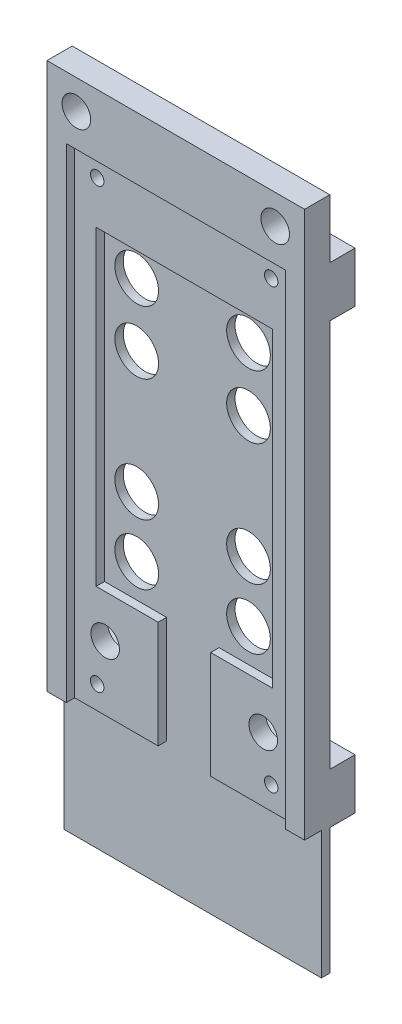
from build123d import *
from build123d.topology import SkipClean

# Parameters (mm, degrees)
SKETCH1_W                   = 32.65
SKETCH1_H                   = 81.2
BOSS_EXTRUDE1_DEPTH         = 1
BOSS_EXTRUDE2_DEPTH         = 4
SKETCH3_W                   = 5.2
SKETCH3_H                   = 5.2
BOSS_EXTRUDE3_DEPTH         = 1
F_3DSKETCH1_R               = 2
CUT_EXTRUDE13_DEPTH         = 15
F_3DSKETCH2_R               = 2.6
CUT_EXTRUDE14_DEPTH         = 24
CUT_EXTRUDE20_START         = -6.9
SKETCH7_R                   = 2
CUT_EXTRUDE20_DEPTH         = 6.9
SKETCH8_W                   = 1
SKETCH8_H                   = 5
CUT_EXTRUDE21_DEPTH         = 88.661066044
SKETCH9_W                   = 5
SKETCH9_H                   = 1
CUT_EXTRUDE23_DEPTH         = 87.935967815
SKETCH11_W                  = 10
SKETCH11_H                  = 6
BOSS_EXTRUDE4_DEPTH         = 3
TAP_DRILL_FOR_M2X0_4_TAP1_D = 1.6
TAP_DRILL_FOR_M2X0_4_TAP2_D = 1.6
SKETCH37_R                  = 0.8
BOSS_EXTRUDE11_DEPTH        = 1
SKETCH40_W                  = 2.3
SKETCH40_H                  = 65
BOSS_EXTRUDE12_DEPTH        = 1
SKETCH41_W                  = 26.05
SKETCH41_H                  = 7.4
BOSS_EXTRUDE13_DEPTH        = 1
M3_CLEARANCE_HOLE1_D        = 3.4
M3_CLEARANCE_HOLE2_D        = 3.4


with BuildPart() as part:
    # Sketch1 → Boss-Extrude1 (new body)
    with BuildSketch(Plane.XY):
        with Locations((16.325, 40.6)):
            Rectangle(SKETCH1_W, SKETCH1_H)
    extrude(amount=BOSS_EXTRUDE1_DEPTH)

    # Sketch2 → Boss-Extrude2 (add)
    with BuildSketch(Plane.XY.offset(1)):
        Polygon((0, 0), (0, 81.2), (32.65, 81.2), (32.65, 0), (31.65, 0), (31.65, 80.2), (1, 80.2), (1, 0), align=None)
    extrude(amount=BOSS_EXTRUDE2_DEPTH)

    # Sketch3 → Boss-Extrude3 (add)
    with BuildSketch(Plane.XY.offset(1)):
        with Locations((3.6, 77.6)):
            Rectangle(SKETCH3_W, SKETCH3_H)
        with Locations((3.6, 17.8)):
            Rectangle(SKETCH3_W, SKETCH3_H)
        with Locations((29.05, 17.8)):
            Rectangle(SKETCH3_W, SKETCH3_H)
        with Locations((29.05, 77.6)):
            Rectangle(SKETCH3_W, SKETCH3_H)
    extrude(amount=BOSS_EXTRUDE3_DEPTH)

    # 3DSketch1 → Cut-Extrude13 (cut)
    with BuildSketch(Plane(origin=(11.325, 80.2, 4), x_dir=(1, 0, 0), z_dir=(0, -1, 0))):
        Circle(F_3DSKETCH1_R)
        with Locations((10, 0)):
            Circle(F_3DSKETCH1_R)
    extrude(amount=-CUT_EXTRUDE13_DEPTH, mode=Mode.SUBTRACT)

    # 3DSketch2 → Cut-Extrude14 (cut)
    with BuildSketch(Plane(origin=(9.675, 61.1, 1), x_dir=(0.4145072564800623, -0.910046006708107, 0), z_dir=(0, 0, 1))):
        with Locations(Location((0, 0, 0), (0, 0, 245.511710088))):
            Circle(F_3DSKETCH2_R)
        with Locations(Location((5.512946511, 12.103611889, 0), (0, 0, 245.511710088))):
            Circle(F_3DSKETCH2_R)
        with Locations(Location((6.82534505, -3.108804424, 0), (0, 0, 245.511710088))):
            Circle(F_3DSKETCH2_R)
        with Locations(Location((12.338291561, 8.994807466, 0), (0, 0, 245.511710088))):
            Circle(F_3DSKETCH2_R)
        with Locations(Location((20.021012148, -9.119159643, 0), (0, 0, 245.511710088))):
            Circle(F_3DSKETCH2_R)
        with Locations(Location((25.533958659, 2.984452247, 0), (0, 0, 245.511710088))):
            Circle(F_3DSKETCH2_R)
        with Locations(Location((26.573343396, -12.103611889, 0), (0, 0, 245.511710088))):
            Circle(F_3DSKETCH2_R)
        with Locations(Location((32.086289907, 0, 0), (0, 0, 245.511710088))):
            Circle(F_3DSKETCH2_R)
    extrude(amount=-CUT_EXTRUDE14_DEPTH, mode=Mode.SUBTRACT)

    # Sketch7 → Cut-Extrude20 (cut)
    with BuildSketch(Plane(origin=(0, 81.2, 0), x_dir=(1, 0, 0), z_dir=(0, 1, 0)).offset(CUT_EXTRUDE20_START)):
        with BuildLine():
            ThreePointArc((13.057050808, -5), (13.256851653, -4.51763809), (13.325, -4))
            ThreePointArc((13.325, -4), (10.80736191, -2.068148347), (9.592949192, -5))
            Line((9.592949192, -5), (13.057050808, -5))
        make_face()
        with BuildLine():
            Line((13.057050808, -5), (9.592949192, -5))
            ThreePointArc((9.592949192, -5), (11.325, -6), (13.057050808, -5))
        make_face()
        with BuildLine():
            ThreePointArc((9.592949192, -5), (11.325, -2), (13.057050808, -5))
            Line((13.057050808, -5), (9.592949192, -5))
        make_face()
        with Locations((21.308255446, -4.002965824)):
            Circle(SKETCH7_R)
    extrude(amount=CUT_EXTRUDE20_DEPTH, mode=Mode.SUBTRACT)

    # Sketch8 → Cut-Extrude21 (cut, through all)
    with BuildSketch(Plane.XZ):
        Polygon((1, 5), (0, 5), (0, 0), (1, 0), (1, 1), align=None)
        with Locations((32.15, 2.5)):
            Rectangle(SKETCH8_W, SKETCH8_H)
    extrude(amount=-CUT_EXTRUDE21_DEPTH, mode=Mode.SUBTRACT)

    # Sketch9 → Cut-Extrude23 (cut, through all)
    with BuildSketch(Plane(origin=(31.65, 0, 0), x_dir=(0, 0, -1), z_dir=(1, 0, 0))):
        with Locations((-2.5, 80.7)):
            Rectangle(SKETCH9_W, SKETCH9_H)
    extrude(amount=-CUT_EXTRUDE23_DEPTH, mode=Mode.SUBTRACT)

    # Sketch11 → Boss-Extrude4 (add)
    with BuildSketch(Plane(origin=(0, 0, 0), x_dir=(-1, 0, 0), z_dir=(0, 0, -1))):
        with Locations((-26.65, 18)):
            Rectangle(SKETCH11_W, SKETCH11_H)
        with Locations((-26.65, 70.2)):
            Rectangle(SKETCH11_W, SKETCH11_H)
        with Locations((-6, 70.2)):
            Rectangle(SKETCH11_W, SKETCH11_H)
        with Locations((-6, 18)):
            Rectangle(SKETCH11_W, SKETCH11_H)
    extrude(amount=BOSS_EXTRUDE4_DEPTH)

    # Tap Drill for M2x0.4 Tap1 (through all)
    with Locations(Plane(origin=(26.675, 70.1, 2), x_dir=(1, 0, 0), z_dir=(0, 0, 1))):
        with Locations((0, 0)):
            Hole(TAP_DRILL_FOR_M2X0_4_TAP1_D / 2)

    # Tap Drill for M2x0.4 Tap2 (through all)
    with Locations(Plane(origin=(5.975, 70.1, 2), x_dir=(1, 0, 0), z_dir=(0, 0, 1))):
        with Locations((0, 0), (0, -52.15), (20.702261821, -52.15)):
            Hole(TAP_DRILL_FOR_M2X0_4_TAP2_D / 2)

    # Sketch37 → Boss-Extrude11 (add)
    with SkipClean():  # the faces are left unmerged after this step: merging them gives an invalid solid
        with BuildSketch(Plane.XY.offset(1)):
            with BuildLine():
                Line((26.85, 64.95), (26.85, 27.95))
                Line((26.85, 27.95), (19.475, 27.95))
                Line((19.475, 27.95), (19.475, 15.2))
                Line((19.475, 15.2), (26.45, 15.2))
                Line((26.45, 15.2), (26.45, 17.18295889))
                ThreePointArc((26.45, 17.18295889), (25.877261821, 17.95), (26.45, 18.71704111))
                Line((26.45, 18.71704111), (26.45, 20.4))
                Line((26.45, 20.4), (31.65, 20.4))
                Line((31.65, 20.4), (31.65, 75))
                Line((31.65, 75), (26.45, 75))
                Line((26.45, 75), (26.45, 80.2))
                Line((26.45, 80.2), (6.2, 80.2))
                Line((6.2, 80.2), (6.2, 75))
                Line((6.2, 75), (1, 75))
                Line((1, 75), (1, 20.4))
                Line((1, 20.4), (6.2, 20.4))
                Line((6.2, 20.4), (6.2, 18.717707627))
                ThreePointArc((6.2, 18.717707627), (6.775, 17.95), (6.2, 17.182292373))
                Line((6.2, 17.182292373), (6.2, 15.2))
                Line((6.2, 15.2), (13.225, 15.2))
                Line((13.225, 15.2), (13.225, 27.95))
                Line((13.225, 27.95), (5.85, 27.95))
                Line((5.85, 27.95), (5.85, 64.95))
                Line((5.85, 64.95), (26.85, 64.95))
            make_face()
            with Locations((5.975, 70.1)):
                Circle(SKETCH37_R, mode=Mode.SUBTRACT)
            with Locations((26.675, 70.1)):
                Circle(SKETCH37_R, mode=Mode.SUBTRACT)
        extrude(amount=BOSS_EXTRUDE11_DEPTH)
    add(part.part.scale(1), mode=Mode.REPLACE)  # the faces are merged on a copy

    # Sketch40 → Boss-Extrude12 (add)
    with BuildSketch(Plane.XY.offset(2)):
        with Locations((30.5, 47.7)):
            Rectangle(SKETCH40_W, SKETCH40_H)
        with Locations((2.15, 47.7)):
            Rectangle(SKETCH40_W, SKETCH40_H)
    extrude(amount=BOSS_EXTRUDE12_DEPTH)

    # Sketch41 → Boss-Extrude13 (add)
    with BuildSketch(Plane.XY.offset(2)):
        with Locations((16.325, 76.5)):
            Rectangle(SKETCH41_W, SKETCH41_H)
    extrude(amount=BOSS_EXTRUDE13_DEPTH)

    # M3 Clearance Hole1 (through all)
    with Locations(Plane(origin=(4.5, 76.7, 3), x_dir=(1, 0, 0), z_dir=(0, 0, 1))):
        with Locations((0, 0), (23.65, 0)):
            Hole(M3_CLEARANCE_HOLE1_D / 2)

    # M3 Clearance Hole2 (through all)
    with Locations(Plane(origin=(6.925, 22.85, 2), x_dir=(1, 0, 0), z_dir=(0, 0, 1))):
        with Locations((0, 0), (18.8, 0)):
            Hole(M3_CLEARANCE_HOLE2_D / 2)


solid = part.part
